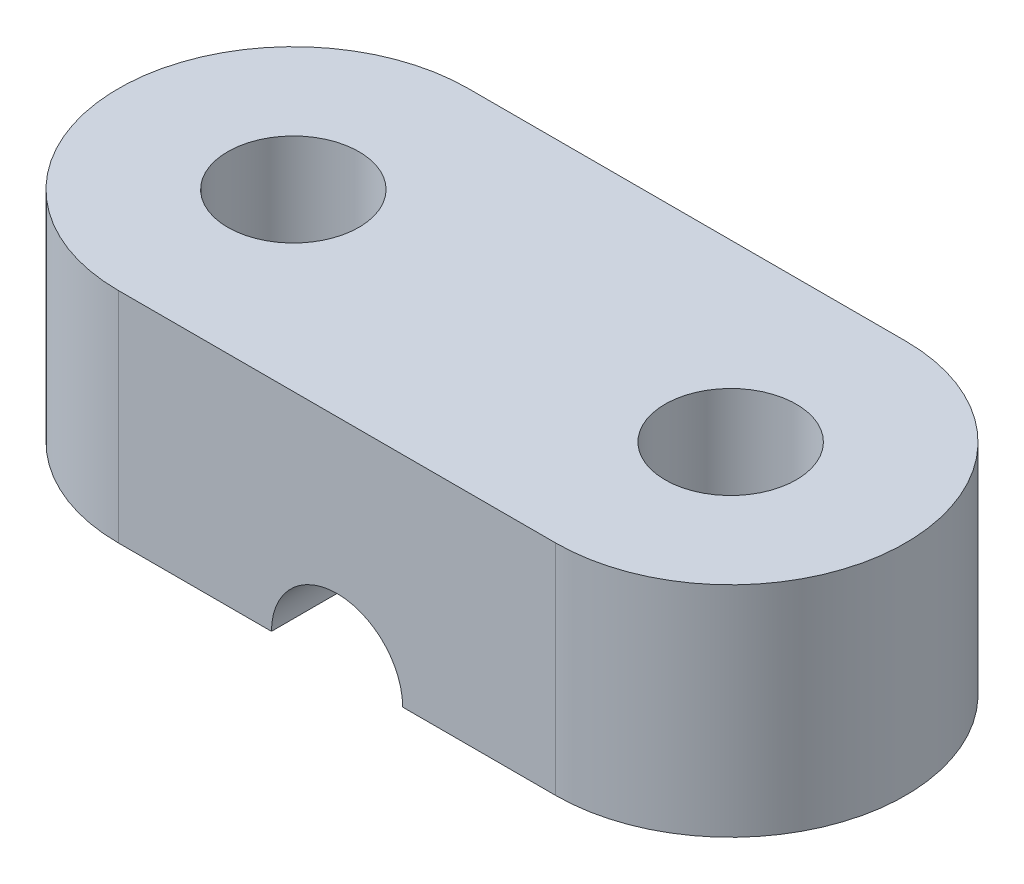
from build123d import *

# Parameters (mm, degrees)
SKETCH2_R           = 1.5
BOSS_EXTRUDE1_DEPTH = 5
SKETCH3_R           = 1.5
CUT_EXTRUDE1_DEPTH  = 14.03840481


with BuildPart() as part:
    # Sketch2 → Boss-Extrude1 (new body)
    with BuildSketch(Plane(origin=(0, 0, 0), x_dir=(1, 0, 0), z_dir=(0, 1, 0))):
        with BuildLine():
            Line((-5, 4), (5, 4))
            ThreePointArc((5, 4), (9, 0), (5, -4))
            Line((5, -4), (-5, -4))
            ThreePointArc((-5, -4), (-9, 0), (-5, 4))
        make_face()
        with Locations((-5, 0)):
            Circle(SKETCH2_R, mode=Mode.SUBTRACT)
        with Locations((5, 0)):
            Circle(SKETCH2_R, mode=Mode.SUBTRACT)
    extrude(amount=BOSS_EXTRUDE1_DEPTH)

    # Sketch3 → Cut-Extrude1 (cut, through all)
    with BuildSketch(Plane.XY.offset(4)):
        Circle(SKETCH3_R)
    extrude(amount=-CUT_EXTRUDE1_DEPTH, mode=Mode.SUBTRACT)


solid = part.part
